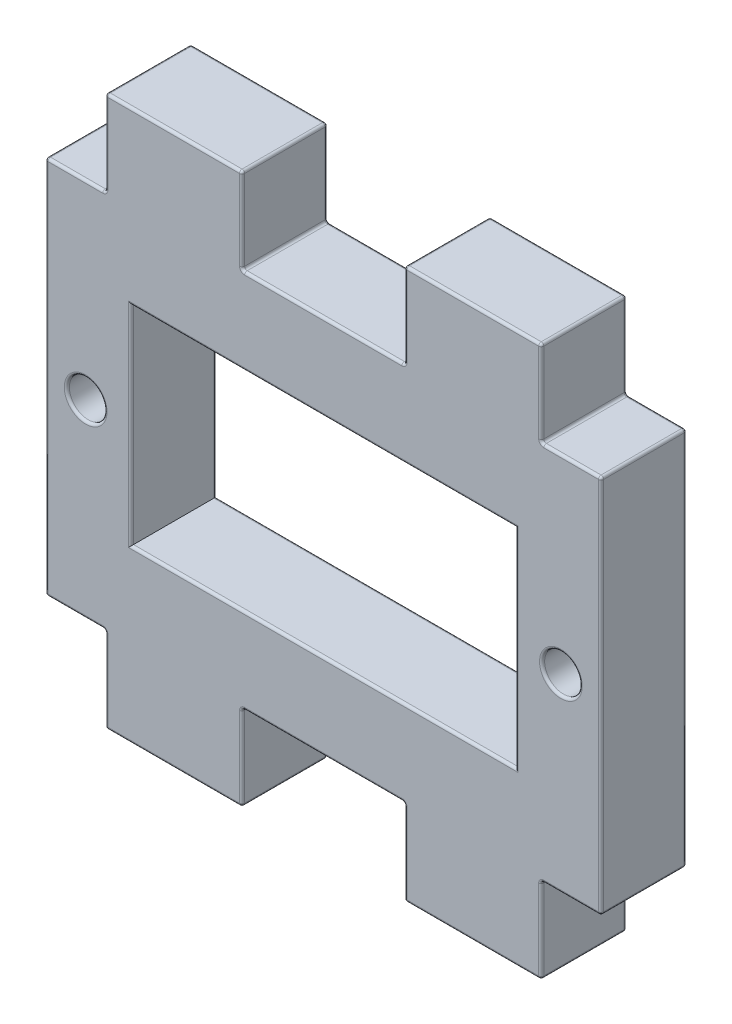
from build123d import *

# Parameters (mm, degrees)
SZKIC1_R                    = 1.1
SZKIC1_W                    = 22.5
SZKIC1_H                    = 12.2
DODANIE_WYCI_GNI_CIE1_DEPTH = 2.5
ZAOKR_GLENIE1_R             = 0.15
ZAOKR_GLENIE2_R             = 0.15


with BuildPart() as part:
    # Szkic1 → Dodanie-wyciągnięcie1 (new, symmetric)
    with BuildSketch(Plane.XY):
        Polygon((-12.75, 11.1), (-16.25, 11.1), (-16.25, -11.1), (-12.75, -11.1), (-12.75, -16.1), (-4.75, -16.1), (-4.75, -11.1), (4.75, -11.1), (4.75, -16.1), (12.75, -16.1), (12.75, -11.1), (16.25, -11.1), (16.25, 11.1), (12.75, 11.1), (12.75, 16.1), (4.75, 16.1), (4.75, 11.1), (-4.75, 11.1), (-4.75, 16.1), (-12.75, 16.1), align=None)
        with Locations((-13.9, 0)):
            Circle(SZKIC1_R, mode=Mode.SUBTRACT)
        Rectangle(SZKIC1_W, SZKIC1_H, mode=Mode.SUBTRACT)
        with Locations((13.9, 0)):
            Circle(SZKIC1_R, mode=Mode.SUBTRACT)
    extrude(amount=DODANIE_WYCI_GNI_CIE1_DEPTH, both=True)

    # Zaokrąglenie1
    zaokr_glenie1_edges = [part.edges().sort_by_distance(p)[0] for p in [
        (-12.75, 16.1, 0),
        (-8.75, 16.1, -2.5),
        (-12.75, 13.6, -2.5),
        (-8.75, 16.1, 2.5),
        (-4.75, 16.1, 0),
        (-12.75, 13.6, 2.5),
        (-12.75, 11.1, 0),
        (-4.75, 13.6, -2.5),
        (-14.5, 11.1, -2.5),
        (-4.75, 13.6, 2.5),
        (-4.75, 11.1, 0),
        (-14.5, 11.1, 2.5),
        (-16.25, 11.1, 0),
        (0, 11.1, -2.5),
        (-16.25, 0, -2.5),
        (0, 11.1, 2.5),
        (4.75, 11.1, 0),
        (-16.25, 0, 2.5),
        (-16.25, -11.1, 0),
        (4.75, 13.6, -2.5),
        (-14.5, -11.1, -2.5),
        (4.75, 13.6, 2.5),
        (4.75, 16.1, 0),
        (-12.75, -11.1, 0),
        (-14.5, -11.1, 2.5),
        (8.75, 16.1, -2.5),
        (-12.75, -13.6, -2.5),
        (12.75, 16.1, 0),
        (8.75, 16.1, 2.5),
        (-12.75, -16.1, 0),
        (-12.75, -13.6, 2.5),
        (12.75, 13.6, -2.5),
        (-8.75, -16.1, -2.5),
        (12.75, 13.6, 2.5),
        (12.75, 11.1, 0),
        (-4.75, -16.1, 0),
        (-8.75, -16.1, 2.5),
        (14.5, 11.1, -2.5),
        (-4.75, -13.6, -2.5),
        (14.5, 11.1, 2.5),
        (16.25, 11.1, 0),
        (-4.75, -13.6, 2.5),
        (-4.75, -11.1, 0),
        (16.25, 0, -2.5),
        (0, -11.1, -2.5),
        (16.25, -11.1, 0),
        (16.25, 0, 2.5),
        (4.75, -11.1, 0),
        (0, -11.1, 2.5),
        (14.5, -11.1, -2.5),
        (4.75, -13.6, -2.5),
        (14.5, -11.1, 2.5),
        (12.75, -11.1, 0),
        (4.75, -16.1, 0),
        (4.75, -13.6, 2.5),
        (12.75, -13.6, -2.5),
        (8.75, -16.1, -2.5),
        (12.75, -13.6, 2.5),
        (8.75, -16.1, 2.5),
        (12.75, -16.1, 0),
    ]]
    fillet(zaokr_glenie1_edges, radius=ZAOKR_GLENIE1_R)

    # Zaokrąglenie2
    zaokr_glenie2_edges = [part.edges().sort_by_distance(p)[0] for p in [
        (12.8, 0, -2.5),
        (-15, 0, -2.5),
        (0, -6.1, -2.5),
        (-11.25, 0, -2.5),
        (0, 6.1, -2.5),
        (11.25, 0, -2.5),
        (0, 6.1, 2.5),
        (-11.25, 0, 2.5),
        (0, -6.1, 2.5),
        (11.25, 0, 2.5),
        (-15, 0, 2.5),
        (12.8, 0, 2.5),
    ]]
    fillet(zaokr_glenie2_edges, radius=ZAOKR_GLENIE2_R)


solid = part.part
